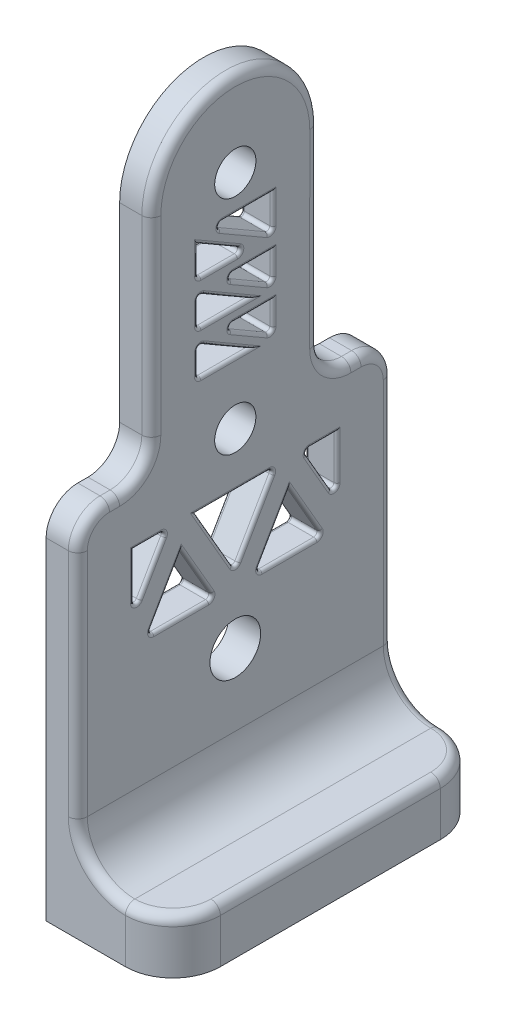
from build123d import *

# Parameters (mm, degrees)
SKETCH2_R           = 6.5
SKETCH2_R_2         = 8
BOSS_EXTRUDE1_DEPTH = 10
SKETCH2_14_W        = 99.4
SKETCH2_14_H        = 17
BOSS_EXTRUDE2_DEPTH = 40
CUT_EXTRUDE1_DEPTH  = 10
FILLET1_R           = 10
FILLET2_R           = 10
FILLET3_R           = 15
FILLET4_R           = 3
CUT_EXTRUDE2_DEPTH  = 10
FILLET5_R           = 1
CUT_EXTRUDE5_DEPTH  = 10
FILLET6_R           = 1


with BuildPart() as part:
    # Sketch2 → Boss-Extrude1 (new body)
    with BuildSketch(Plane(origin=(0, 0, 0), x_dir=(0, 0, -1), z_dir=(1, 0, 0))):
        with BuildLine():
            Line((-49.7, 130), (-49.7, 0))
            Line((-49.7, 0), (-49.7, -37.7))
            Line((-49.7, -37.7), (49.7, -37.7))
            Line((49.7, -37.7), (49.7, 0))
            Line((49.7, 0), (49.7, 130))
            ThreePointArc((49.7, 130), (0, 179.7), (-49.7, 130))
        make_face()
        with Locations((-0.006451274, 60)):
            Circle(SKETCH2_R, mode=Mode.SUBTRACT)
        Circle(SKETCH2_R_2, mode=Mode.SUBTRACT)
        with Locations((0, 130)):
            Circle(SKETCH2_R, mode=Mode.SUBTRACT)
    extrude(amount=BOSS_EXTRUDE1_DEPTH)

    # Sketch2<14> → Boss-Extrude2 (add)
    with BuildSketch(Plane(origin=(0, 0, 0), x_dir=(0, 0, -1), z_dir=(1, 0, 0))):
        with Locations((0, -46.2)):
            Rectangle(SKETCH2_14_W, SKETCH2_14_H)
    extrude(amount=BOSS_EXTRUDE2_DEPTH)

    # Sketch10 → Cut-Extrude1 (cut)
    with BuildSketch(Plane.ZY):
        with BuildLine():
            ThreePointArc((-26.49999955, 129.995115464), (-0.002442268, 156.499999887), (26.5, 130))
            Line((26.5, 130), (26.5, 60))
            Line((26.5, 60), (49.7, 60))
            Line((49.7, 60), (49.7, 130))
            ThreePointArc((49.7, 130), (0, 179.7), (-49.7, 130))
            Line((-49.7, 130), (-49.7, 59.990795531))
            Line((-49.7, 59.990795531), (-49.687096609, 59.990840381))
            Line((-49.687096609, 59.990840381), (-26.487097003, 59.995116653))
            Line((-26.487097003, 59.995116653), (-26.49999955, 129.995115464))
        make_face()
    extrude(amount=-CUT_EXTRUDE1_DEPTH, mode=Mode.SUBTRACT)

    # Fillet1
    fillet1_edges = [part.edges().sort_by_distance(p)[0] for p in [
        (5, 60, 26.5),
        (5, 59.995116653, -26.487097003),
    ]]
    fillet(fillet1_edges, radius=FILLET1_R)

    # Fillet2
    fillet2_edges = [part.edges().sort_by_distance(p)[0] for p in [
        (5, 60, 49.7),
        (5, 59.990795531, -49.7),
    ]]
    fillet(fillet2_edges, radius=FILLET2_R)

    # Fillet3
    fillet3_edges = [part.edges().sort_by_distance(p)[0] for p in [
        (40, -46.2, -49.7),
        (10, -37.7, 0),
        (40, -46.2, 49.7),
    ]]
    fillet(fillet3_edges, radius=FILLET3_R - 0.0001)  # a hair under: the kernel refuses the full size

    # Fillet4
    fillet4_edges = [part.edges().sort_by_distance(p)[0] for p in [
        (40, -37.7, 0),
        (35.606631007, -37.7, 45.306631007),
        (35.606631007, -37.7, -45.306631007),
        (10, 13.64995, 49.7),
        (14.393368993, -33.306631007, -49.7),
        (14.393368993, -33.306631007, 49.7),
        (10, 100, 26.5),
        (10, 156.499999887, -0.002442268),
        (10, 99.995115974, -26.494469887),
        (10, 60, 38.1),
        (10, 59.992977158, -38.094470027),
        (10, 62.928932188, 29.428932188),
        (10, 62.923508925, -29.416569008),
        (10, 13.646290527, -49.7),
        (10, 57.063097158, -46.771719459),
        (10, 57.071067812, 46.771067812),
    ]]
    fillet(fillet4_edges, radius=FILLET4_R)

    # Sketch11 → Cut-Extrude2 (cut)
    with BuildSketch(Plane(origin=(10, 0, 0), x_dir=(0, 0, -1), z_dir=(1, 0, 0))):
        Polygon((17.07337409, 35.000001224), (6.681068537, 17), (27.465679642, 17), align=None)
        Polygon((32.084481795, 43.000001224), (21.692176243, 43.000001224), (32.084481795, 25), align=None)
        Polygon((12.454571936, 43.000001224), (-12.454571936, 43.000001224), (0, 21.428049844), align=None)
        Polygon((-17.07337409, 35.000001224), (-27.465679642, 17), (-6.681068537, 17), align=None)
        Polygon((-21.692176243, 43.000001224), (-32.084481795, 43.000001224), (-32.084481795, 25), align=None)
    extrude(amount=-CUT_EXTRUDE2_DEPTH, mode=Mode.SUBTRACT)

    # Fillet5
    fillet5_edges = [part.edges().sort_by_distance(p)[0] for p in [
        (10, 34.000000612, -26.888329019),
        (5, 25, -32.084481795),
        (10, 43.000001224, -26.888329019),
        (5, 43.000001224, -21.692176243),
        (10, 34.000000612, -32.084481795),
        (0, 34.000000612, -26.888329019),
        (0, 43.000001224, -26.888329019),
        (0, 34.000000612, -32.084481795),
        (10, 43.000001224, 0),
        (10, 32.214025534, -6.227285968),
        (5, 43.000001224, -12.454571936),
        (0, 32.214025534, 6.227285968),
        (5, 21.428049844, 0),
        (0, 43.000001224, 0),
        (0, 32.214025534, -6.227285968),
        (10, 32.214025534, 6.227285968),
        (0, 34.000000612, 32.084481795),
        (5, 25, 32.084481795),
        (10, 43.000001224, 26.888329019),
        (0, 34.000000612, 26.888329019),
        (5, 43.000001224, 21.692176243),
        (0, 43.000001224, 26.888329019),
        (10, 34.000000612, 32.084481795),
        (10, 34.000000612, 26.888329019),
        (10, 26.000000612, 11.877221314),
        (0, 17, 17.07337409),
        (5, 17, 6.681068537),
        (10, 26.000000612, 22.269526866),
        (5, 17, 27.465679642),
        (0, 26.000000612, 11.877221314),
        (0, 26.000000612, 22.269526866),
        (10, 17, 17.07337409),
        (0, 26.000000612, -22.269526866),
        (0, 17, -17.07337409),
        (5, 17, -27.465679642),
        (0, 26.000000612, -11.877221314),
        (5, 17, -6.681068537),
        (10, 26.000000612, -22.269526866),
        (10, 26.000000612, -11.877221314),
        (10, 17, -17.07337409),
    ]]
    fillet(fillet5_edges, radius=FILLET5_R)

    # Sketch13 → Cut-Extrude5 (cut)
    with BuildSketch(Plane(origin=(10, 0, 0), x_dir=(0, 0, -1), z_dir=(1, 0, 0))):
        Polygon((4.412119954, 79.542678869), (-11.876221569, 88.946757232), (-11.876221569, 79.542678869), align=None)
        Polygon((11.876221569, 79.852079945), (11.876221569, 89.256158309), (-4.412119954, 89.256158309), align=None)
        Polygon((4.412119954, 93.256158309), (-11.876221569, 102.660236672), (-11.876221569, 93.256158309), align=None)
        Polygon((11.876221569, 93.565559385), (11.876221569, 102.969637748), (-4.412119954, 102.969637748), align=None)
        Polygon((4.412119954, 106.969637748), (-11.876221569, 116.373716111), (-11.876221569, 106.969637748), align=None)
        Polygon((11.876221569, 118.683117188), (-7.876221569, 118.683117188), (11.876221569, 107.279038825), align=None)
    extrude(amount=-CUT_EXTRUDE5_DEPTH, mode=Mode.SUBTRACT)

    # Fillet6
    fillet6_edges = [part.edges().sort_by_distance(p)[0] for p in [
        (10, 106.969637748, 3.732050808),
        (5, 106.969637748, -4.412119954),
        (0, 111.67167693, 11.876221569),
        (5, 106.969637748, 11.876221569),
        (10, 111.67167693, 3.732050808),
        (0, 106.969637748, 3.732050808),
        (0, 111.67167693, 3.732050808),
        (10, 111.67167693, 11.876221569),
        (0, 102.969637748, -3.732050808),
        (5, 102.969637748, 4.412119954),
        (10, 98.267598567, -11.876221569),
        (0, 98.267598567, -3.732050808),
        (5, 93.565559385, -11.876221569),
        (0, 98.267598567, -11.876221569),
        (10, 102.969637748, -3.732050808),
        (10, 98.267598567, -3.732050808),
        (10, 93.256158309, 3.732050808),
        (0, 97.95819749, 11.876221569),
        (5, 93.256158309, 11.876221569),
        (10, 97.95819749, 3.732050808),
        (5, 102.660236672, 11.876221569),
        (0, 93.256158309, 3.732050808),
        (0, 97.95819749, 3.732050808),
        (10, 97.95819749, 11.876221569),
        (0, 89.256158309, -3.732050808),
        (5, 89.256158309, 4.412119954),
        (10, 84.554119127, -11.876221569),
        (0, 84.554119127, -3.732050808),
        (5, 79.852079945, -11.876221569),
        (0, 84.554119127, -11.876221569),
        (10, 89.256158309, -3.732050808),
        (10, 84.554119127, -3.732050808),
        (10, 118.683117188, -2),
        (5, 118.683117188, 7.876221569),
        (10, 112.981078007, -11.876221569),
        (0, 112.981078007, -2),
        (5, 107.279038825, -11.876221569),
        (0, 118.683117188, -2),
        (0, 112.981078007, -11.876221569),
        (10, 112.981078007, -2),
        (10, 79.542678869, 3.732050808),
        (0, 84.24471805, 11.876221569),
        (5, 79.542678869, 11.876221569),
        (10, 84.24471805, 3.732050808),
        (5, 88.946757232, 11.876221569),
        (0, 79.542678869, 3.732050808),
        (0, 84.24471805, 3.732050808),
        (10, 84.24471805, 11.876221569),
    ]]
    fillet(fillet6_edges, radius=FILLET6_R)


solid = part.part
